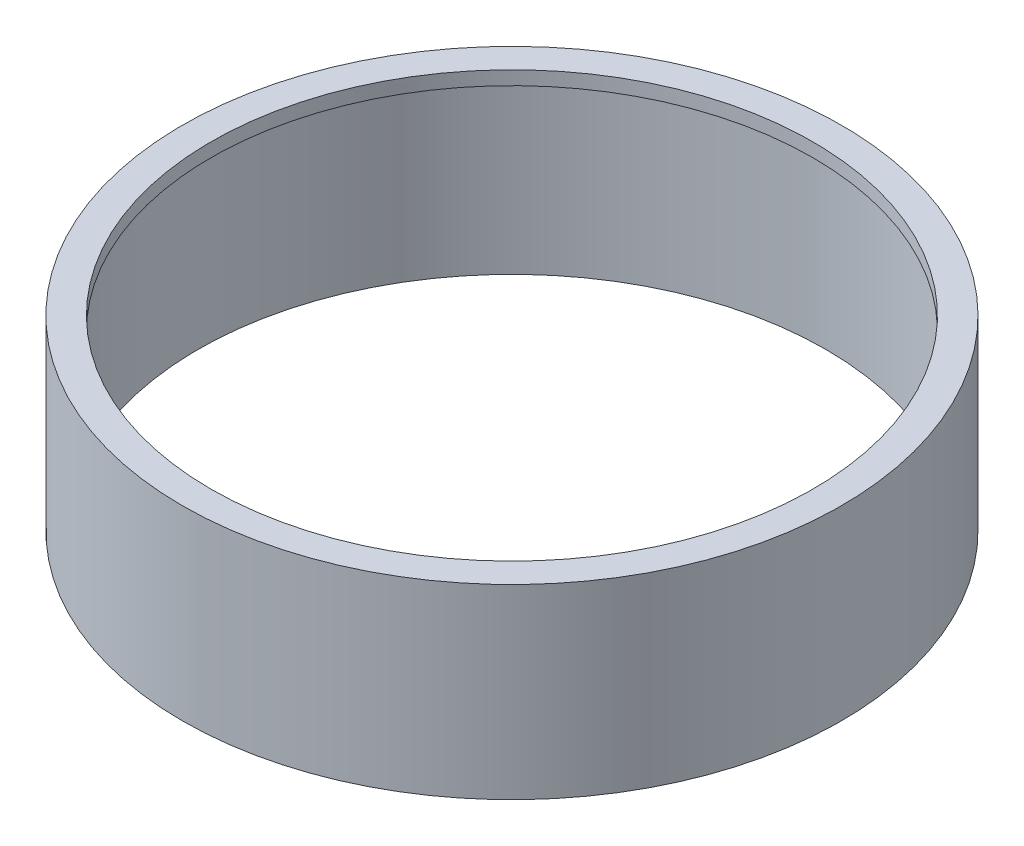
from build123d import *

# Parameters (mm, degrees)
SKETCH1_R           = 40.005
BOSS_EXTRUDE1_DEPTH = 22.62
SKETCH3_R           = 38.1
CUT_EXTRUDE1_DEPTH  = 20.95
SKETCH4_R           = 36.525
CUT_EXTRUDE2_DEPTH  = 61.929996307


with BuildPart() as part:
    # Sketch1 → Boss-Extrude1 (new body)
    with BuildSketch(Plane(origin=(0, 0, 0), x_dir=(1, 0, 0), z_dir=(0, 1, 0))):
        Circle(SKETCH1_R)
    extrude(amount=BOSS_EXTRUDE1_DEPTH)

    # Sketch3 → Cut-Extrude1 (cut)
    with BuildSketch(Plane(origin=(0, 0, 0), x_dir=(-1, 0, 0), z_dir=(0, -1, 0))):
        Circle(SKETCH3_R)
    extrude(amount=-CUT_EXTRUDE1_DEPTH, mode=Mode.SUBTRACT)

    # Sketch4 → Cut-Extrude2 (cut, through all)
    with BuildSketch(Plane(origin=(0, 22.62, 0), x_dir=(1, 0, 0), z_dir=(0, 1, 0))):
        Circle(SKETCH4_R)
    extrude(amount=-CUT_EXTRUDE2_DEPTH, mode=Mode.SUBTRACT)


solid = part.part
